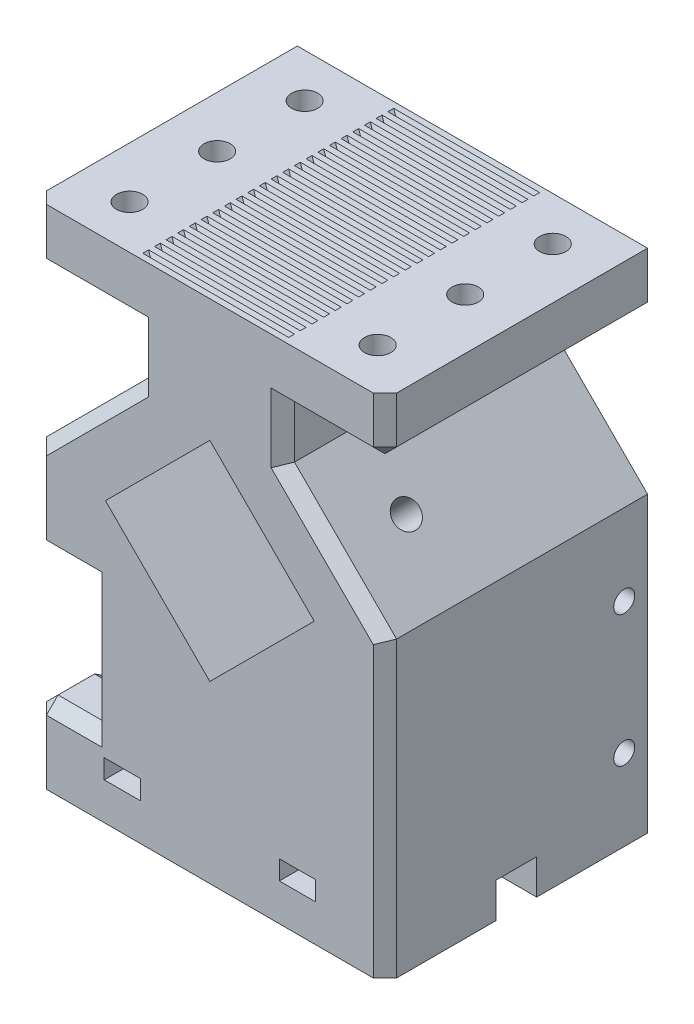
from build123d import *

# Parameters (mm, degrees)
BOSS_EXTRUDE1_DEPTH = 45
CUT_EXTRUDE1_DEPTH  = 25
CUT_EXTRUDE2_DEPTH  = 6
CUT_EXTRUDE4_DEPTH  = 9.5
CUT_EXTRUDE5_DEPTH  = 4.5
FILLET1_R           = 6
CUT_EXTRUDE7_DEPTH  = 23
CHAMFER1_SIZE       = 1
SKETCH8_R           = 2.25
CUT_EXTRUDE8_DEPTH  = 10
CUT_EXTRUDE9_DEPTH  = 3.2
SKETCH10_R          = 1.75
CUT_EXTRUDE10_DEPTH = 20
SKETCH11_W          = 6.2
SKETCH11_H          = 12
CUT_EXTRUDE11_DEPTH = 3.3
CUT_EXTRUDE12_DEPTH = 1.5
SKETCH13_R          = 1.5
CUT_EXTRUDE13_DEPTH = 15
SKETCH14_R          = 2.25
CUT_EXTRUDE14_DEPTH = 15
CUT_EXTRUDE15_DEPTH = 3.5
SKETCH16_R          = 1.8
CUT_EXTRUDE23_DEPTH = 20
SKETCH17_W          = 3.3
SKETCH17_H          = 6.2
CUT_EXTRUDE24_DEPTH = 8
CUT_EXTRUDE25_DEPTH = 1.5
CHAMFER2_SIZE       = 2


with BuildPart() as part:
    # Sketch1 → Boss-Extrude1 (new body)
    with BuildSketch(Plane.XY):
        Polygon((-30, 25.15), (-12.5, 42.65), (-12.5, 51.65), (-30, 51.65), (-30, 61.65), (30, 61.65), (30, 51.65), (12.5, 51.65), (12.5, 42.65), (30, 25.15), (30, -25.15), (-30, -25.15), align=None)
    extrude(amount=BOSS_EXTRUDE1_DEPTH)

    # Sketch2 → Cut-Extrude1 (cut)
    with BuildSketch(Plane.XY.offset(45)):
        Polygon((0, 40.629603128), (-17.889801564, 22.739801564), (0, 4.85), (17.889801564, 22.739801564), align=None)
    extrude(amount=-CUT_EXTRUDE1_DEPTH, mode=Mode.SUBTRACT)

    # Sketch3 → Cut-Extrude2 (cut)
    with BuildSketch(Plane.XZ.offset(25.15)):
        Polygon((-30, 26), (30, 26), (30, 19), (4.5, 19), (4.5, 3), (-4.5, 3), (-4.5, 19), (-30, 19), align=None)
    extrude(amount=-CUT_EXTRUDE2_DEPTH, mode=Mode.SUBTRACT)

    # Sketch4 → Cut-Extrude4 (cut)
    with BuildSketch(Plane.ZY.offset(30)):
        Polygon((45, 9.85), (28.5, 9.85), (19, -19.15), (26, -19.15), (36.75, -12.15), (45, -12.15), align=None)
    extrude(amount=-CUT_EXTRUDE4_DEPTH, mode=Mode.SUBTRACT)

    # Sketch5 → Cut-Extrude5 (cut, symmetric)
    with BuildSketch(Plane(origin=(0, 0, 0), x_dir=(0, 0, -1), z_dir=(1, 0, 0))):
        with BuildLine():
            Line((-3, -19.15), (-3, 9.566528763))
            ThreePointArc((-3, 9.566528763), (-3.277698296, 11.37076356), (-4.085087734, 13.007987381))
            Line((-4.085087734, 13.007987381), (-11.208490038, 23.181260182))
            ThreePointArc((-11.208490038, 23.181260182), (-13.352910624, 25.061866563), (-16.123402303, 25.739801564))
            Line((-16.123402303, 25.739801564), (-20, 25.739801564))
            Line((-20, 25.739801564), (-20, 19.739801564))
            Line((-20, 19.739801564), (-19.246804607, 19.739801564))
            ThreePointArc((-19.246804607, 19.739801564), (-16.476312927, 19.061866563), (-14.331892341, 17.181260182))
            Line((-14.331892341, 17.181260182), (-10.085087734, 11.116194648))
            ThreePointArc((-10.085087734, 11.116194648), (-9.277698296, 9.478970827), (-9, 7.67473603))
            Line((-9, 7.67473603), (-9, -19.15))
            Line((-9, -19.15), (-3, -19.15))
        make_face()
    extrude(amount=CUT_EXTRUDE5_DEPTH, both=True, mode=Mode.SUBTRACT)

    # Fillet1
    fillet1_edges = [part.edges().sort_by_distance(p)[0] for p in [
        (0, -19.15, 9),
    ]]
    fillet(fillet1_edges, radius=FILLET1_R)

    # Sketch7 → Cut-Extrude7 (cut)
    with BuildSketch(Plane(origin=(11.5, 0, 0), x_dir=(0, 0, -1), z_dir=(1, 0, 0))):
        Polygon((-1, 61.65), (-2, 61.65), (-1.5, 60.65), align=None)
        Polygon((-4, 61.65), (-3.5, 60.65), (-3, 61.65), align=None)
        Polygon((-6, 61.65), (-5.5, 60.65), (-5, 61.65), align=None)
        Polygon((-8, 61.65), (-7.5, 60.65), (-7, 61.65), align=None)
        Polygon((-10, 61.65), (-9.5, 60.65), (-9, 61.65), align=None)
        Polygon((-12, 61.65), (-11.5, 60.65), (-11, 61.65), align=None)
        Polygon((-14, 61.65), (-13.5, 60.65), (-13, 61.65), align=None)
        Polygon((-16, 61.65), (-15.5, 60.65), (-15, 61.65), align=None)
        Polygon((-18, 61.65), (-17.5, 60.65), (-17, 61.65), align=None)
        Polygon((-20, 61.65), (-19.5, 60.65), (-19, 61.65), align=None)
        Polygon((-22, 61.65), (-21.5, 60.65), (-21, 61.65), align=None)
        Polygon((-24, 61.65), (-23.5, 60.65), (-23, 61.65), align=None)
        Polygon((-26, 61.65), (-25.5, 60.65), (-25, 61.65), align=None)
        Polygon((-28, 61.65), (-27.5, 60.65), (-27, 61.65), align=None)
        Polygon((-30, 61.65), (-29.5, 60.65), (-29, 61.65), align=None)
        Polygon((-32, 61.65), (-31.5, 60.65), (-31, 61.65), align=None)
        Polygon((-34, 61.65), (-33.5, 60.65), (-33, 61.65), align=None)
        Polygon((-36, 61.65), (-35.5, 60.65), (-35, 61.65), align=None)
        Polygon((-38, 61.65), (-37.5, 60.65), (-37, 61.65), align=None)
        Polygon((-40, 61.65), (-39.5, 60.65), (-39, 61.65), align=None)
        Polygon((-42, 61.65), (-41.5, 60.65), (-41, 61.65), align=None)
        Polygon((-44, 61.65), (-43.5, 60.65), (-43, 61.65), align=None)
    extrude(amount=-CUT_EXTRUDE7_DEPTH, mode=Mode.SUBTRACT)

    # Chamfer1
    chamfer1_edges = [part.edges().sort_by_distance(p)[0] for p in [
        (-11.5, 61.65, 43.5),
        (-11.5, 61.65, 41.5),
        (-11.5, 61.65, 39.5),
        (-11.5, 61.65, 37.5),
        (-11.5, 61.65, 35.5),
        (-11.5, 61.65, 33.5),
        (-11.5, 61.65, 31.5),
        (-11.5, 61.65, 29.5),
        (-11.5, 61.65, 27.5),
        (-11.5, 61.65, 25.5),
        (-11.5, 61.65, 23.5),
        (-11.5, 61.65, 21.5),
        (-11.5, 61.65, 19.5),
        (-11.5, 61.65, 17.5),
        (-11.5, 61.65, 15.5),
        (-11.5, 61.65, 13.5),
        (-11.5, 61.65, 11.5),
        (-11.5, 61.65, 9.5),
        (-11.5, 61.65, 7.5),
        (-11.5, 61.65, 5.5),
        (-11.5, 61.65, 3.5),
        (-11.5, 61.65, 1.5),
        (11.5, 61.65, 43.5),
        (11.5, 61.65, 41.5),
        (11.5, 61.65, 39.5),
        (11.5, 61.65, 37.5),
        (11.5, 61.65, 35.5),
        (11.5, 61.65, 33.5),
        (11.5, 61.65, 31.5),
        (11.5, 61.65, 29.5),
        (11.5, 61.65, 27.5),
        (11.5, 61.65, 25.5),
        (11.5, 61.65, 23.5),
        (11.5, 61.65, 21.5),
        (11.5, 61.65, 19.5),
        (11.5, 61.65, 17.5),
        (11.5, 61.65, 15.5),
        (11.5, 61.65, 13.5),
        (11.5, 61.65, 11.5),
        (11.5, 61.65, 9.5),
        (11.5, 61.65, 7.5),
        (11.5, 61.65, 5.5),
        (11.5, 61.65, 3.5),
        (11.5, 61.65, 1.5),
    ]]
    chamfer(chamfer1_edges, length=CHAMFER1_SIZE - 0.0001)  # a hair under: the kernel refuses the full size

    # Sketch8 → Cut-Extrude8 (cut)
    with BuildSketch(Plane(origin=(0, 61.65, 0), x_dir=(1, 0, 0), z_dir=(0, 1, 0))):
        with Locations(Location((-21.25, -37.5, 0), (0, 0, 270))):
            Circle(SKETCH8_R)
        with Locations(Location((-21.25, -22.5, 0), (0, 0, 270))):
            Circle(SKETCH8_R)
        with Locations(Location((-21.25, -7.5, 0), (0, 0, 270))):
            Circle(SKETCH8_R)
        with Locations(Location((21.25, -7.5, 0), (0, 0, 270))):
            Circle(SKETCH8_R)
        with Locations(Location((21.25, -22.5, 0), (0, 0, 270))):
            Circle(SKETCH8_R)
        with Locations(Location((21.25, -37.5, 0), (0, 0, 270))):
            Circle(SKETCH8_R)
    extrude(amount=-CUT_EXTRUDE8_DEPTH, mode=Mode.SUBTRACT)

    # Sketch9 → Cut-Extrude9 (cut)
    with BuildSketch(Plane.XZ.offset(-51.65)):
        Polygon((-25.291451884, 22.5), (-23.270725942, 19), (-19.229274058, 19), (-17.208548116, 22.5), (-19.229274058, 26), (-23.270725942, 26), align=None)
        Polygon((-25.291451884, 37.5), (-23.270725942, 34), (-19.229274058, 34), (-17.208548116, 37.5), (-19.229274058, 41), (-23.270725942, 41), align=None)
        Polygon((-25.291451884, 7.5), (-23.270725942, 4), (-19.229274058, 4), (-17.208548116, 7.5), (-19.229274058, 11), (-23.270725942, 11), align=None)
        Polygon((25.291451884, 7.5), (23.270725942, 11), (19.229274058, 11), (17.208548116, 7.5), (19.229274058, 4), (23.270725942, 4), align=None)
        Polygon((25.483397492, 22.610819848), (23.46267155, 26.110819848), (19.421219665, 26.110819848), (17.400493723, 22.610819848), (19.421219665, 19.110819848), (23.46267155, 19.110819848), align=None)
        Polygon((25.483397492, 37.610819848), (23.46267155, 41.110819848), (19.421219665, 41.110819848), (17.400493723, 37.610819848), (19.421219665, 34.110819848), (23.46267155, 34.110819848), align=None)
    extrude(amount=-CUT_EXTRUDE9_DEPTH, mode=Mode.SUBTRACT)

    # Sketch10 → Cut-Extrude10 (cut)
    with BuildSketch(Plane.XZ.offset(25.15)):
        with Locations((-15, 37.5)):
            Circle(SKETCH10_R)
        with Locations((-15, 7.5)):
            Circle(SKETCH10_R)
        with Locations((15, 7.5)):
            Circle(SKETCH10_R)
        with Locations((15, 37.5)):
            Circle(SKETCH10_R)
    extrude(amount=-CUT_EXTRUDE10_DEPTH, mode=Mode.SUBTRACT)

    # Sketch11 → Cut-Extrude11 (cut)
    with BuildSketch(Plane(origin=(0, -18.8, 0), x_dir=(-1, 0, 0), z_dir=(0, -1, 0))):
        with Locations((-15, -39)):
            Rectangle(SKETCH11_W, SKETCH11_H)
        with Locations((15, -39)):
            Rectangle(SKETCH11_W, SKETCH11_H)
        with Locations((15, -6)):
            Rectangle(SKETCH11_W, SKETCH11_H)
        with Locations((-15, -6)):
            Rectangle(SKETCH11_W, SKETCH11_H)
    extrude(amount=-CUT_EXTRUDE11_DEPTH, mode=Mode.SUBTRACT)

    # Sketch12 → Cut-Extrude12 (cut)
    with BuildSketch(Plane(origin=(0, -18.8, 0), x_dir=(-1, 0, 0), z_dir=(0, -1, 0))):
        Polygon((15, -34.035898385), (12, -35.767949192), (12, -39.232050808), (15, -40.964101615), (18, -39.232050808), (18, -35.767949192), align=None)
        Polygon((15, -10.964101615), (18, -9.232050808), (18, -5.767949192), (15, -4.035898385), (12, -5.767949192), (12, -9.232050808), align=None)
        Polygon((-15, -10.964101615), (-12, -9.232050808), (-12, -5.767949192), (-15, -4.035898385), (-18, -5.767949192), (-18, -9.232050808), align=None)
        Polygon((-15, -34.035898385), (-18, -35.767949192), (-18, -39.232050808), (-15, -40.964101615), (-12, -39.232050808), (-12, -35.767949192), align=None)
    extrude(amount=CUT_EXTRUDE12_DEPTH, mode=Mode.SUBTRACT)

    # Sketch13 → Cut-Extrude13 (cut)
    with BuildSketch(Plane.ZY.offset(20.5)):
        with Locations((41, -5.9)):
            Circle(SKETCH13_R)
        with Locations((41, 3.6)):
            Circle(SKETCH13_R)
    extrude(amount=-CUT_EXTRUDE13_DEPTH, mode=Mode.SUBTRACT)

    # Sketch14 → Cut-Extrude14 (cut)
    with BuildSketch(Plane(origin=(-27.575, 27.575, 0), x_dir=(0, 0, 1), z_dir=(-0.7071067811865477, 0.7071067811865475, 0))):
        with Locations(Location((32.5, 9.070532111, 0), (0, 0, 270))):
            Circle(SKETCH14_R)
    cut_extrude14 = extrude(amount=-CUT_EXTRUDE14_DEPTH, mode=Mode.SUBTRACT)

    # Sketch15 → Cut-Extrude15 (cut)
    with BuildSketch(Plane(origin=(-20.314801564, 20.314801564, 0), x_dir=(0, 0, -1), z_dir=(0.7071067811865477, -0.7071067811865475, 0))):
        Polygon((-28.458548116, 9.070532111), (-30.479274058, 12.570532111), (-34.520725942, 12.570532111), (-36.541451884, 9.070532111), (-34.520725942, 5.570532111), (-30.479274058, 5.570532111), align=None)
    cut_extrude15 = extrude(amount=-CUT_EXTRUDE15_DEPTH, mode=Mode.SUBTRACT)

    # Mirror1: Cut-Extrude14, Cut-Extrude15 across plane
    add(cut_extrude14.mirror(Plane(origin=(0, 0, 0), x_dir=(0, 0, 1), z_dir=(1, 0, 0))), mode=Mode.SUBTRACT)
    add(cut_extrude15.mirror(Plane(origin=(0, 0, 0), x_dir=(0, 0, 1), z_dir=(1, 0, 0))), mode=Mode.SUBTRACT)

    # Sketch16 → Cut-Extrude23 (cut)
    with BuildSketch(Plane(origin=(30, 0, 0), x_dir=(0, 0, -1), z_dir=(1, 0, 0))):
        with Locations(Location((-4, 11.25, 0), (0, 0, 90))):
            Circle(SKETCH16_R)
        with Locations(Location((-4, -11.25, 0), (0, 0, 90))):
            Circle(SKETCH16_R)
    extrude(amount=-CUT_EXTRUDE23_DEPTH, mode=Mode.SUBTRACT)

    # Sketch17 → Cut-Extrude24 (cut)
    with BuildSketch(Plane(origin=(0, 0, 0), x_dir=(-1, 0, 0), z_dir=(0, 0, -1))):
        with Locations((-22, -11.25)):
            Rectangle(SKETCH17_W, SKETCH17_H)
        with Locations((-22, 11.25)):
            Rectangle(SKETCH17_W, SKETCH17_H)
    extrude(amount=-CUT_EXTRUDE24_DEPTH, mode=Mode.SUBTRACT)

    # Sketch18 → Cut-Extrude25 (cut)
    with BuildSketch(Plane.ZY.offset(-23.65)):
        Polygon((0.824573519, 11.25), (2.41228676, 8.5), (5.58771324, 8.5), (7.175426481, 11.25), (5.58771324, 14), (2.41228676, 14), align=None)
        Polygon((0.824573519, -11.25), (2.41228676, -14), (5.58771324, -14), (7.175426481, -11.25), (5.58771324, -8.5), (2.41228676, -8.5), align=None)
    extrude(amount=-CUT_EXTRUDE25_DEPTH, mode=Mode.SUBTRACT)

    # Chamfer2
    chamfer2_edges = [part.edges().sort_by_distance(p)[0] for p in [
        (-30, -25.15, 35.5),
        (-30, -22.15, 26),
        (-30, -15.65, 31.375),
        (-30, -12.15, 40.875),
        (-30, -18.65, 45),
        (-30, -22.15, 19),
        (-30, -4.65, 23.75),
        (-30, 9.85, 36.75),
        (-25.25, -12.15, 45),
        (-20.5, -1.15, 45),
        (-25.25, 9.85, 45),
        (-30, 17.5, 45),
        (-30, 51.65, 22.5),
        (-21.25, 33.9, 45),
        (-12.5, 47.15, 45),
        (-21.25, 51.65, 45),
        (-30, 56.65, 45),
        (30, 0, 45),
        (21.25, 33.9, 45),
        (12.5, 47.15, 45),
        (21.25, 51.65, 45),
        (30, 56.65, 45),
        (30, 51.65, 22.5),
    ]]
    chamfer(chamfer2_edges, length=CHAMFER2_SIZE)


solid = part.part
